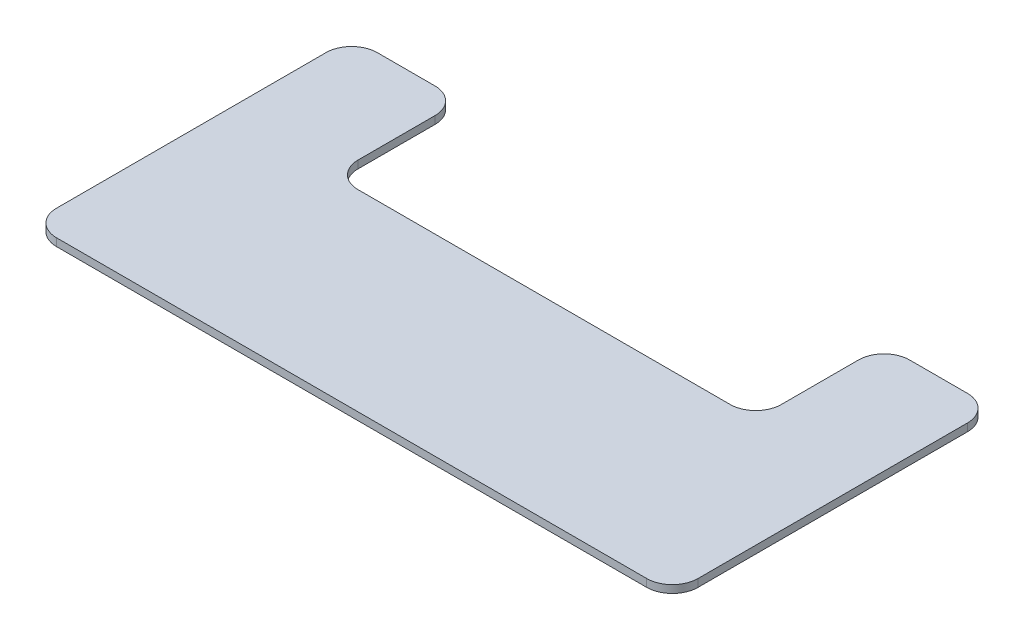
from build123d import *

# Parameters (mm, degrees)
BASE_FLANGE1_DEPTH = 3


# Sheet-metal steps are written as plain solids
with BuildPart() as part:
    # Sketch16 → Base-Flange1 (new body)
    with BuildSketch(Plane(origin=(0, 0, 0), x_dir=(1, 0, 0), z_dir=(0, 1, 0))):
        with BuildLine():
            Line((-50, 0), (50, 0))
            Line((50, 0), (115, 0))
            ThreePointArc((115, 0), (122.071067812, 2.928932188), (125, 10))
            Line((125, 10), (125, 75))
            Line((125, 75), (125, 115))
            ThreePointArc((125, 115), (122.071067812, 122.071067812), (115, 125))
            Line((115, 125), (92.5, 125))
            ThreePointArc((92.5, 125), (85.428932188, 122.071067812), (82.5, 115))
            Line((82.5, 115), (82.5, 85))
            ThreePointArc((82.5, 85), (79.571067812, 77.928932188), (72.5, 75))
            Line((72.5, 75), (50, 75))
            Line((50, 75), (-50, 75))
            Line((-50, 75), (-72.5, 75))
            ThreePointArc((-72.5, 75), (-79.571067812, 77.928932188), (-82.5, 85))
            Line((-82.5, 85), (-82.5, 115))
            ThreePointArc((-82.5, 115), (-85.428932188, 122.071067812), (-92.5, 125))
            Line((-92.5, 125), (-115, 125))
            ThreePointArc((-115, 125), (-122.071067812, 122.071067812), (-125, 115))
            Line((-125, 115), (-125, 75))
            Line((-125, 75), (-125, 10))
            ThreePointArc((-125, 10), (-122.071067812, 2.928932188), (-115, 0))
            Line((-115, 0), (-50, 0))
        make_face()
    extrude(amount=-BASE_FLANGE1_DEPTH)


solid = part.part
